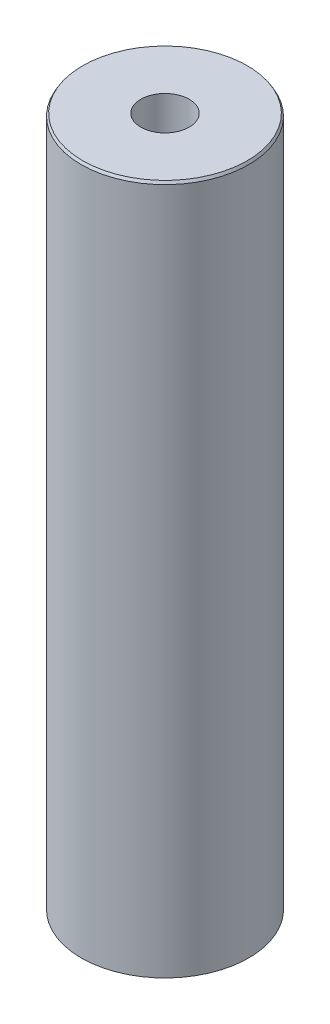
from build123d import *
from OCP.BRepFilletAPI import BRepFilletAPI_MakeChamfer

# Parameters (mm, degrees)
SKETCH1_R           = 30
BOSS_EXTRUDE1_DEPTH = 247.376403996
SKETCH2_R           = 8.665122203
CUT_EXTRUDE1_DEPTH  = 251.988217361
CHAMFER1_SIZE       = 0.935199554
CHAMFER1_SIZE2      = 0.539937714


with BuildPart() as part:
    # Sketch1 → Boss-Extrude1 (new body)
    with BuildSketch(Plane(origin=(0, 0, 0), x_dir=(1, 0, 0), z_dir=(0, 1, 0))):
        Circle(SKETCH1_R)
    extrude(amount=BOSS_EXTRUDE1_DEPTH)

    # Sketch2 → Cut-Extrude1 (cut, through all)
    with BuildSketch(Plane(origin=(0, 0, 0), x_dir=(1, 0, 0), z_dir=(0, 1, 0))):
        Circle(SKETCH2_R)
    extrude(amount=CUT_EXTRUDE1_DEPTH, mode=Mode.SUBTRACT)

    # Chamfer1: one chamfer whose edges measure the first distance from different faces: ONE call of the kernel's chamfer builder (chamfer() names one face for all edges)
    chamfer1_edges_1 = [part.edges().sort_by_distance(p)[0] for p in [
        (-30, 247.376403996, 0),
    ]]
    chamfer1_side_1 = [part.faces().sort_by_distance(p)[0] for p in [
        (-30, 123.688201998, 0),
    ]]
    chamfer1_edges_2 = [part.edges().sort_by_distance(p)[0] for p in [
        (-30, 0, 0),
    ]]
    chamfer1_side_2 = [part.faces().sort_by_distance(p)[0] for p in [
        (-29.151471863, 0, 0),
    ]]
    chamfer1 = BRepFilletAPI_MakeChamfer(part.part.solid().wrapped)
    for e in chamfer1_edges_1:
        chamfer1.Add(CHAMFER1_SIZE, CHAMFER1_SIZE2, e.wrapped, chamfer1_side_1[0].wrapped)  # the first distance lies on this face
    for e in chamfer1_edges_2:
        chamfer1.Add(CHAMFER1_SIZE, CHAMFER1_SIZE2, e.wrapped, chamfer1_side_2[0].wrapped)  # the first distance lies on this face
    add(Compound.cast(chamfer1.Shape()), mode=Mode.REPLACE)


solid = part.part
